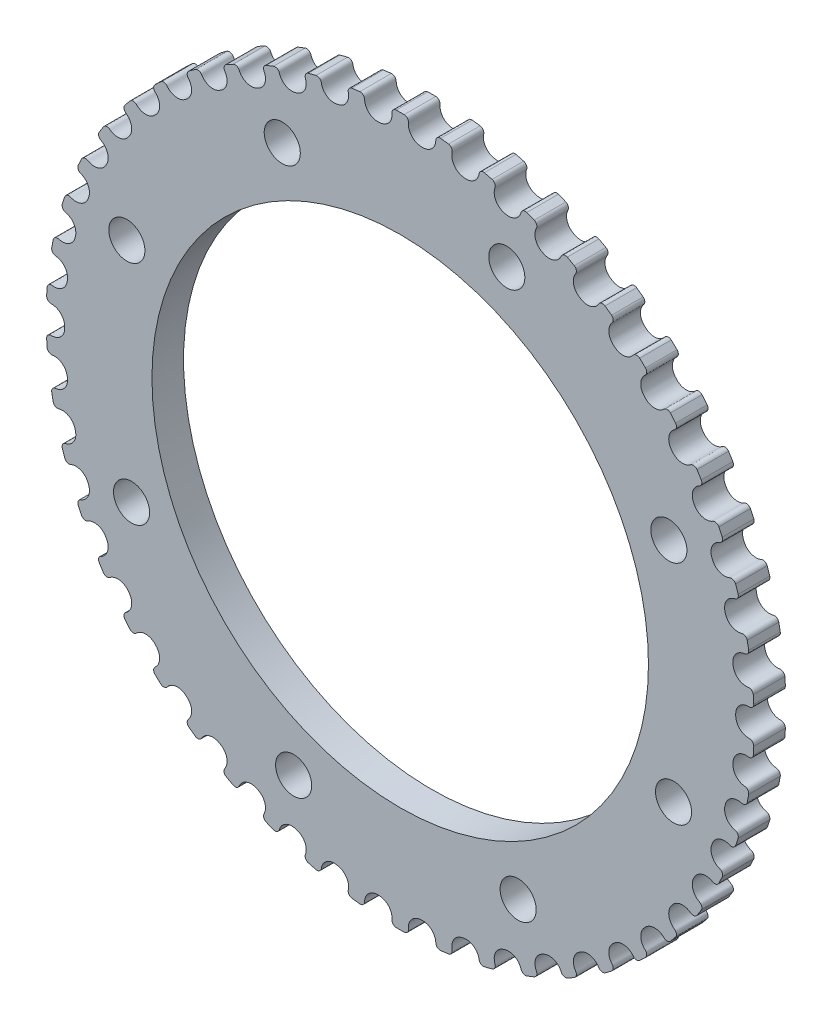
from build123d import *

# Parameters (mm, degrees)
SKETCHREVOLVEGEARBELT01_W       = 3.5
SKETCHREVOLVEGEARBELT01_H       = 39.217218411
TOOTHEXTRUDECUTGEARBELT01_DEPTH = 7.238999891
PATTERNGEARBELT01_COUNT         = 50
BOREREVOLVESKETCH_W             = 14.477999782
BOREREVOLVESKETCH_H             = 27.5
SKETCH1_R                       = 2
CUT_EXTRUDE1_DEPTH              = 10


with BuildPart() as part:
    # SketchRevolveGearBelt01 → GearBelt01 (revolve)
    with BuildSketch(Plane(origin=(0, 0, 0), x_dir=(0, 0, -1), z_dir=(1, 0, 0))):
        with Locations((0, 19.608609206)):
            Rectangle(SKETCHREVOLVEGEARBELT01_W, SKETCHREVOLVEGEARBELT01_H)
    revolve(axis=Axis((0, 0, 0), (0, 0, -1)))

    # SketchToothGearBelt01 → ToothExtrudeCutGearBelt01 (cut, symmetric)
    with BuildSketch(Plane.XY):
        with BuildLine():
            ThreePointArc((39.164679022, 2.032334243), (39.217374535, 0), (39.164679022, -2.032334243))
            add(Edge.make_bspline(
                [(39.164679022, -2.032334243), (39.166048883, -2.005984565), (39.164883295, -1.966294001), (39.156943231, -1.91408071), (39.147835553, -1.875531869), (39.135634795, -1.83784758), (39.12042125, -1.801275572), (39.102294908, -1.766056265), (39.081374934, -1.732421187), (39.057798852, -1.700591449), (39.031721649, -1.670776298), (39.003314752, -1.64317173), (38.972764904, -1.617959231), (38.940272938, -1.59530448), (38.906052449, -1.575356646), (38.870328405, -1.558245974), (38.833335623, -1.544088262), (38.795317397, -1.532964211), (38.756523252, -1.524993116), (38.717209712, -1.520055082), (38.66580266, -1.5184582), (38.589994052, -1.519756698), (38.489697952, -1.516042965), (38.377509936, -1.502613699), (38.266707897, -1.480535762), (38.157982142, -1.449806634), (38.052000418, -1.410652745), (37.949416183, -1.363305357), (37.850861265, -1.308058822), (37.756942857, -1.245252774), (37.668239537, -1.175274325), (37.585297771, -1.098554529), (37.50862852, -1.015566038), (37.43870413, -0.926820101), (37.375955295, -0.832863447), (37.320768875, -0.73427489), (37.27348376, -0.631661826), (37.234395318, -0.525656278), (37.203729181, -0.416911781), (37.181730901, -0.306096466), (37.168324647, -0.193899714), (37.165224472, -0.105119728), (37.165512565, -0.040500395), (37.16545238, 0), (37.165512565, 0.040500395), (37.165224472, 0.105119728), (37.168324647, 0.193899714), (37.181730901, 0.306096466), (37.203729181, 0.416911781), (37.234395318, 0.525656278), (37.27348376, 0.631661826), (37.320768875, 0.73427489), (37.375955295, 0.832863447), (37.43870413, 0.926820101), (37.50862852, 1.015566038), (37.585297771, 1.098554529), (37.668239537, 1.175274325), (37.756942857, 1.245252774), (37.850861265, 1.308058822), (37.949416183, 1.363305357), (38.052000418, 1.410652745), (38.157982142, 1.449806634), (38.266707897, 1.480535762), (38.377509936, 1.502613699), (38.489697952, 1.516042965), (38.589994052, 1.519756698), (38.66580266, 1.5184582), (38.717209712, 1.520055082), (38.756523252, 1.524993116), (38.795317397, 1.532964211), (38.833335623, 1.544088262), (38.870328405, 1.558245974), (38.906052449, 1.575356646), (38.940272938, 1.59530448), (38.972764904, 1.617959231), (39.003314752, 1.64317173), (39.031721649, 1.670776298), (39.057798852, 1.700591449), (39.081374934, 1.732421187), (39.102294908, 1.766056265), (39.12042125, 1.801275572), (39.135634795, 1.83784758), (39.147835553, 1.875531869), (39.156943231, 1.91408071), (39.164883295, 1.966294001), (39.166048883, 2.005984565), (39.164679022, 2.032334243)],
                knots=[0, 0, 0, 0, 0.012346399, 0.018519598, 0.024692797, 0.030865997, 0.037039196, 0.043212395, 0.049385595, 0.055558794, 0.061731993, 0.067905193, 0.074078392, 0.080251591, 0.086424791, 0.09259799, 0.09877119, 0.104944389, 0.111117588, 0.117290788, 0.123463987, 0.135171051, 0.152780618, 0.170390185, 0.187999752, 0.205609319, 0.223218886, 0.240828453, 0.25843802, 0.276047587, 0.293657154, 0.311266721, 0.328876288, 0.346485855, 0.364095422, 0.381704989, 0.399314555, 0.416924122, 0.434533689, 0.452143256, 0.469752823, 0.48736239, 0.493681195, 0.5, 0.506318805, 0.51263761, 0.530247177, 0.547856744, 0.565466311, 0.583075878, 0.600685445, 0.618295011, 0.635904578, 0.653514145, 0.671123712, 0.688733279, 0.706342846, 0.723952413, 0.74156198, 0.759171547, 0.776781114, 0.794390681, 0.812000248, 0.829609815, 0.847219382, 0.864828949, 0.876536013, 0.882709212, 0.888882412, 0.895055611, 0.90122881, 0.90740201, 0.913575209, 0.919748409, 0.925921608, 0.932094807, 0.938268007, 0.944441206, 0.950614405, 0.956787605, 0.962960804, 0.969134003, 0.975307203, 0.981480402, 0.987653601, 1, 1, 1, 1], degree=3))
        make_face()
    toothextrudecutgearbelt01 = extrude(amount=TOOTHEXTRUDECUTGEARBELT01_DEPTH, both=True, mode=Mode.SUBTRACT)

    # PatternGearBelt01: ToothExtrudeCutGearBelt01 ×50 about axis
    patterngearbelt01_axis = Axis((0, 0, 55), (0, 0, -1))
    for i in range(1, PATTERNGEARBELT01_COUNT):
        add(toothextrudecutgearbelt01.rotate(patterngearbelt01_axis, i * 360 / PATTERNGEARBELT01_COUNT), mode=Mode.SUBTRACT)

    # BoreRevolveSketch → BoreRevolveCut (revolve, cut)
    with BuildSketch(Plane(origin=(0, 0, 0), x_dir=(0, 0, -1), z_dir=(1, 0, 0))):
        with Locations((0, 13.75)):
            Rectangle(BOREREVOLVESKETCH_W, BOREREVOLVESKETCH_H)
    revolve(axis=Axis((0, 0, 0), (0, 0, -1)), mode=Mode.SUBTRACT)

    # Sketch1 → Cut-Extrude1 (cut)
    with BuildSketch(Plane.XY.offset(1.75)):
        with Locations((11.80531616, 30.280100897)):
            Circle(SKETCH1_R)
        with Locations((29.75888379, 13.063645569)):
            Circle(SKETCH1_R)
        with Locations((30.280100897, -11.80531616)):
            Circle(SKETCH1_R)
        with Locations((13.063645569, -29.75888379)):
            Circle(SKETCH1_R)
        with Locations((-11.80531616, -30.280100897)):
            Circle(SKETCH1_R)
        with Locations((-29.75888379, -13.063645569)):
            Circle(SKETCH1_R)
        with Locations((-30.280100897, 11.80531616)):
            Circle(SKETCH1_R)
        with Locations((-13.063645569, 29.75888379)):
            Circle(SKETCH1_R)
    extrude(amount=-CUT_EXTRUDE1_DEPTH, mode=Mode.SUBTRACT)


solid = part.part
